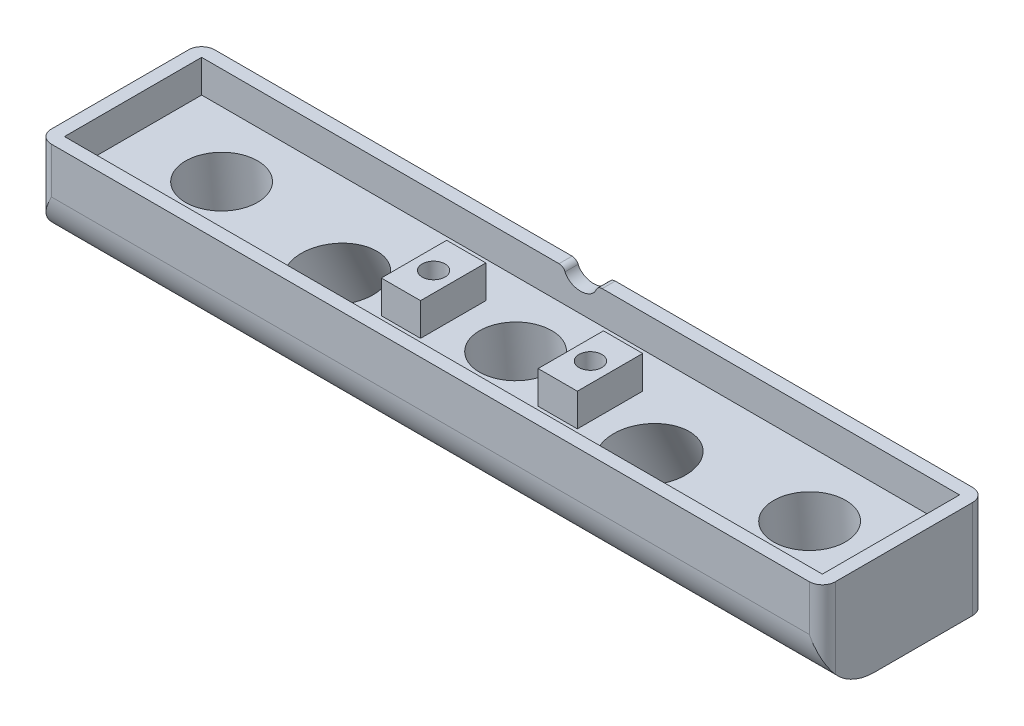
from build123d import *

# Parameters (mm, degrees)
BASE_W                 = 120
BASE_H                 = 25
BASE_EXT_DEPTH         = 10
SKETCH3_R              = 5.5
LED_BOTTOM_CUT_DEPTH   = 63.469697574
LED_FOR_TOP_ROW_R      = 5.5
LED_TOP_CUT_DEPTH      = 65.13752525
SKETCH5_W              = 120
SKETCH5_H              = 25
SKETCH5_W_2            = 116
SKETCH5_H_2            = 21
WIRE_BOX_RIM_DEPTH     = 5
SKETCH6_W              = 6
SKETCH6_H              = 10
SUPPORT_SPACERS_DEPTH  = 5
SKETCH8_R              = 1.75
M3_SCREW_CUT_DEPTH     = 64.097147321
M3_NUT_CUT_DEPTH       = 3.5
WIRE_CUT_OUT_RX        = 2.5
WIRE_CUT_OUT_RY        = 2
WIRE_CUT_OUT_CUT_DEPTH = 2
FILLET1_R              = 1
FILLET2_R              = 1
FILLET3_R              = 2
FILLET4_R              = 2
FILLET5_R              = 2
FILLET6_R              = 2
FILLET7_R              = 8


with BuildPart() as part:
    # Base → Base EXT (new body)
    with BuildSketch(Plane(origin=(0, 0, 0), x_dir=(1, 0, 0), z_dir=(0, 1, 0))):
        Rectangle(BASE_W, BASE_H)
    extrude(amount=BASE_EXT_DEPTH)

    # Sketch3 → LED bottom CUT (cut, through all)
    with BuildSketch(Plane(origin=(0, 11.009339875, 0.963192432), x_dir=(1, 0, 0), z_dir=(0, 0.9961946980917455, 0.08715574274765836))):
        with Locations(Location((-45, 1.419123701, 0), (0, 0, 270))):
            Circle(SKETCH3_R)
        with Locations(Location((0, 1.419123701, 0), (0, 0, 270))):
            Circle(SKETCH3_R)
        with Locations(Location((45, 1.419123701, 0), (0, 0, 270))):
            Circle(SKETCH3_R)
    extrude(amount=-LED_BOTTOM_CUT_DEPTH, mode=Mode.SUBTRACT)

    # LED for Top Row → LED top CUT (cut, through all)
    with BuildSketch(Plane(origin=(0, 13.001715818, 6.062799655), x_dir=(1, 0, 0), z_dir=(0, 0.9063077870366496, 0.4226182617407003))):
        with Locations(Location((-23.903258736, 1.647335279, 0), (0, 0, 270))):
            Circle(LED_FOR_TOP_ROW_R)
        with Locations(Location((23.903258736, 1.647335279, 0), (0, 0, 270))):
            Circle(LED_FOR_TOP_ROW_R)
    extrude(amount=-LED_TOP_CUT_DEPTH, mode=Mode.SUBTRACT)

    # Sketch5 → Wire Box Rim (add)
    with BuildSketch(Plane(origin=(0, 10, 0), x_dir=(1, 0, 0), z_dir=(0, 1, 0))):
        Rectangle(SKETCH5_W, SKETCH5_H)
        Rectangle(SKETCH5_W_2, SKETCH5_H_2, mode=Mode.SUBTRACT)
    extrude(amount=WIRE_BOX_RIM_DEPTH)

    # Sketch6 → Support Spacers (add)
    with BuildSketch(Plane(origin=(0, 10, 0), x_dir=(1, 0, 0), z_dir=(0, 1, 0))):
        with Locations((-12, 0)):
            Rectangle(SKETCH6_W, SKETCH6_H)
        with Locations((12, 0)):
            Rectangle(SKETCH6_W, SKETCH6_H)
    extrude(amount=SUPPORT_SPACERS_DEPTH)

    # Sketch8 → M3 Screw CUT (cut, through all)
    with BuildSketch(Plane(origin=(0, 15, 0), x_dir=(1, 0, 0), z_dir=(0, 1, 0))):
        with Locations(Location((12, 0, 0), (0, 0, 270))):
            Circle(SKETCH8_R)
        with Locations(Location((-12, 0, 0), (0, 0, 90))):
            Circle(SKETCH8_R)
    extrude(amount=-M3_SCREW_CUT_DEPTH, mode=Mode.SUBTRACT)

    # M3 Nut → M3 Nut CUT (cut)
    with BuildSketch(Plane.XZ):
        Polygon((-12, 3.175426481), (-14.75, 1.58771324), (-14.75, -1.58771324), (-12, -3.175426481), (-9.25, -1.58771324), (-9.25, 1.58771324), align=None)
        Polygon((9.25, 1.58771324), (12, 3.175426481), (14.75, 1.58771324), (14.75, -1.58771324), (12, -3.175426481), (9.25, -1.58771324), align=None)
    extrude(amount=-M3_NUT_CUT_DEPTH, mode=Mode.SUBTRACT)

    # Wire cut out → Wire cut out CUT (cut)
    with BuildSketch(Plane(origin=(0, 0, -12.5), x_dir=(-1, 0, 0), z_dir=(0, 0, -1))):
        with Locations(Location((0, 15), (0, 0, 180))):
            Ellipse(WIRE_CUT_OUT_RX, WIRE_CUT_OUT_RY)
    extrude(amount=-WIRE_CUT_OUT_CUT_DEPTH, mode=Mode.SUBTRACT)

    # Fillet1
    fillet1_edges = [part.edges().sort_by_distance(p)[0] for p in [
        (2.5, 15, -11.5),
    ]]
    fillet(fillet1_edges, radius=FILLET1_R)

    # Fillet2
    fillet2_edges = [part.edges().sort_by_distance(p)[0] for p in [
        (-2.5, 15, -11.5),
    ]]
    fillet(fillet2_edges, radius=FILLET2_R)

    # Fillet3
    fillet3_edges = [part.edges().sort_by_distance(p)[0] for p in [
        (-60, 7.5, -12.5),
    ]]
    fillet(fillet3_edges, radius=FILLET3_R)

    # Fillet4
    fillet4_edges = [part.edges().sort_by_distance(p)[0] for p in [
        (60, 7.5, -12.5),
    ]]
    fillet(fillet4_edges, radius=FILLET4_R)

    # Fillet5
    fillet5_edges = [part.edges().sort_by_distance(p)[0] for p in [
        (60, 7.5, 12.5),
    ]]
    fillet(fillet5_edges, radius=FILLET5_R)

    # Fillet6
    fillet6_edges = [part.edges().sort_by_distance(p)[0] for p in [
        (-60, 7.5, 12.5),
    ]]
    fillet(fillet6_edges, radius=FILLET6_R)

    # Fillet7
    # the kernel refuses this fillet: 8 mm, written as the material it takes off along each edge
    with BuildSketch(Plane(origin=(78, 0, 12.5), x_dir=(0, 1, 0), z_dir=(-1, 0, 0))) as fillet7_piece_1:
        with BuildLine():
            CenterArc((FILLET7_R, FILLET7_R), FILLET7_R, 180, 90)
            Line((0, FILLET7_R), (0, 0))
            Line((0, 0), (FILLET7_R, 0))
        make_face()
    extrude(amount=156, mode=Mode.SUBTRACT)


solid = part.part
